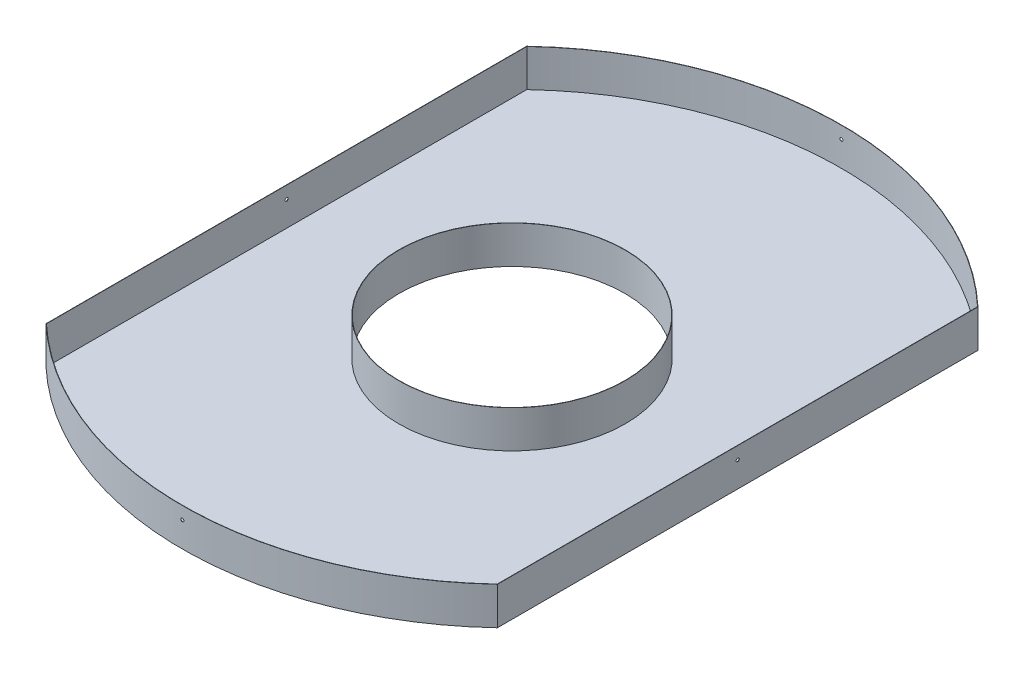
from build123d import *

# Parameters (mm, degrees)
SKETCH1_R                = 1750
BOSS_EXTRUDE1_DEPTH      = 500
SKETCH2_R                = 900
CUT_EXTRUDE2_DEPTH       = 300
CUT_EXTRUDE10_DEPTH      = 2525.876234591
CUT_EXTRUDE10_DEPTH_BACK = 2525.876234591
SKETCH10_W               = 4401.17604026
SKETCH10_H               = 5623.086471134
SKETCH10_W_2             = 2396.119838962
SKETCH10_H_2             = 4339.917258658
SKETCH3_R                = 600
CUT_EXTRUDE3_DEPTH       = 300
SHELL1_T                 = -1.5
SKETCH11_W               = 3093.35758239
SKETCH11_H               = 4860.990486612
CUT_EXTRUDE11_DEPTH      = 2142.92613567
SKETCH7_R                = 8.382
CUT_EXTRUDE6_DEPTH       = 900
CIRPATTERN1_COUNT        = 4
SKETCH13_R               = 901.5
SKETCH13_R_2             = 601.5
CUT_EXTRUDE14_DEPTH      = 10


with BuildPart() as part:
    # Sketch1 → Boss-Extrude1 (new body)
    with BuildSketch(Plane(origin=(0, 0, 0), x_dir=(1, 0, 0), z_dir=(0, 1, 0))):
        Circle(SKETCH1_R)
    extrude(amount=BOSS_EXTRUDE1_DEPTH)

    # Sketch2 → Cut-Extrude2 (cut)
    with BuildSketch(Plane(origin=(0, 500, 0), x_dir=(1, 0, 0), z_dir=(0, 1, 0))):
        Circle(SKETCH2_R)
    extrude(amount=-CUT_EXTRUDE2_DEPTH, mode=Mode.SUBTRACT)

    # Sketch10 → Cut-Extrude10 (cut, two sides: drawn at the far end of the back side and taken through both)
    with BuildSketch(Plane(origin=(0, 500, 0), x_dir=(1, 0, 0), z_dir=(0, 1, 0)).offset(-CUT_EXTRUDE10_DEPTH_BACK)):
        Rectangle(SKETCH10_W, SKETCH10_H)
        Rectangle(SKETCH10_W_2, SKETCH10_H_2, mode=Mode.SUBTRACT)
    extrude(amount=CUT_EXTRUDE10_DEPTH + CUT_EXTRUDE10_DEPTH_BACK, mode=Mode.SUBTRACT)

    # Sketch3 → Cut-Extrude3 (cut)
    with BuildSketch(Plane.XZ):
        Circle(SKETCH3_R)
    extrude(amount=-CUT_EXTRUDE3_DEPTH, mode=Mode.SUBTRACT)

    # Shell1
    shell1_openings = [part.faces().sort_by_distance(p)[0] for p in [
        (1155.643660473, 500, 0),
    ]]
    offset(amount=SHELL1_T, openings=shell1_openings, kind=Kind.INTERSECTION)

    # Sketch11 → Cut-Extrude11 (cut, through all)
    with BuildSketch(Plane(origin=(0, 200, 0), x_dir=(1, 0, 0), z_dir=(0, 1, 0))):
        Rectangle(SKETCH11_W, SKETCH11_H)
    extrude(amount=CUT_EXTRUDE11_DEPTH, mode=Mode.SUBTRACT)

    # Sketch7 → Cut-Extrude6 (cut)
    with BuildSketch(Plane.XY.offset(2000)):
        with Locations((0, 133.897639423)):
            Circle(SKETCH7_R)
    cut_extrude6 = extrude(amount=-CUT_EXTRUDE6_DEPTH, mode=Mode.SUBTRACT)

    # CirPattern1: Cut-Extrude6 ×4 about axis
    cirpattern1_axis = Axis((0, 500, 0), (0, -1, 0))
    for i in range(1, CIRPATTERN1_COUNT):
        add(cut_extrude6.rotate(cirpattern1_axis, i * 360 / CIRPATTERN1_COUNT), mode=Mode.SUBTRACT)

    # Sketch13 → Cut-Extrude14 (cut)
    with BuildSketch(Plane(origin=(0, 200, 0), x_dir=(1, 0, 0), z_dir=(0, 1, 0))):
        Circle(SKETCH13_R)
        Circle(SKETCH13_R_2, mode=Mode.SUBTRACT)
    extrude(amount=-CUT_EXTRUDE14_DEPTH, mode=Mode.SUBTRACT)


solid = part.part
